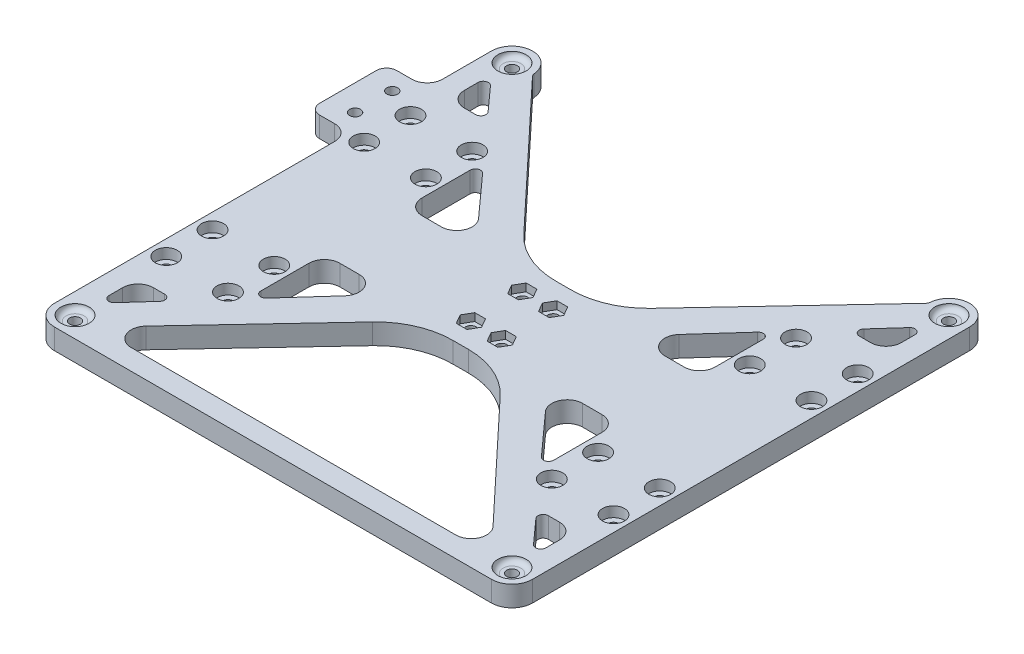
from build123d import *

# Parameters (mm, degrees)
SKETCH1_R           = 2.1
BOSS_EXTRUDE1_DEPTH = 8
FILLET2_R           = 4
SKETCH2_R           = 2.1
CUT_EXTRUDE1_DEPTH  = 10
CUT_EXTRUDE2_DEPTH  = 3
SKETCH4_R           = 2.125
CUT_EXTRUDE3_DEPTH  = 10
CUT_EXTRUDE4_DEPTH  = 3
SKETCH6_W           = 36
SKETCH6_H           = 32
SKETCH6_W_2         = 55
BOSS_EXTRUDE2_DEPTH = 8
SKETCH7_R           = 2.1
CUT_EXTRUDE5_DEPTH  = 10
SKETCH8_W           = 28
SKETCH8_H           = 6.5
SKETCH8_W_2         = 23
SKETCH8_H_2         = 6
BOSS_EXTRUDE3_DEPTH = 8
FILLET3_R           = 6
FILLET4_R           = 2
FILLET5_R           = 30
SKETCH9_R           = 4.25
CUT_EXTRUDE6_DEPTH  = 4
SKETCH10_R          = 5.5
CUT_EXTRUDE7_DEPTH  = 2
FILLET6_R           = 2


with BuildPart() as part:
    # Sketch1 → Boss-Extrude1 (new body)
    with BuildSketch(Plane(origin=(0, 0, 0), x_dir=(1, 0, 0), z_dir=(0, 1, 0))):
        with BuildLine():
            Line((8, 170), (69, 105))
            Line((69, 105), (101, 105))
            Line((101, 105), (162, 170))
            ThreePointArc((162, 170), (170, 178), (178, 170))
            Line((178, 170), (178, 0))
            ThreePointArc((178, 0), (175.656854249, -5.656854249), (170, -8))
            Line((170, -8), (0, -8))
            ThreePointArc((0, -8), (-5.656854249, -5.656854249), (-8, 0))
            Line((-8, 0), (-8, 115))
            Line((-8, 115), (-23.805991578, 115))
            Line((-23.805991578, 115), (-23.805991578, 145))
            Line((-23.805991578, 145), (-8, 145))
            Line((-8, 145), (-8, 170))
            ThreePointArc((-8, 170), (0, 178), (8, 170))
        make_face()
        with Locations(Location((0, 170, 0), (0, 0, 270))):
            Circle(SKETCH1_R, mode=Mode.SUBTRACT)
        with Locations(Location((170, 170, 0), (0, 0, 270))):
            Circle(SKETCH1_R, mode=Mode.SUBTRACT)
        with Locations(Location((170, 0, 0), (0, 0, 270))):
            Circle(SKETCH1_R, mode=Mode.SUBTRACT)
        with Locations(Location((0, 0, 0), (0, 0, 270))):
            Circle(SKETCH1_R, mode=Mode.SUBTRACT)
        Polygon((0, 162), (55, 101), (0, 101), align=None, mode=Mode.SUBTRACT)
        Polygon((55, 69), (0, 8), (0, 69), align=None, mode=Mode.SUBTRACT)
        Polygon((8, 0), (69, 65), (101, 65), (162, 0), align=None, mode=Mode.SUBTRACT)
        Polygon((170, 8), (115, 69), (115, 101), (170, 162), align=None, mode=Mode.SUBTRACT)
    extrude(amount=BOSS_EXTRUDE1_DEPTH)

    # Fillet2
    fillet2_edges = [part.edges().sort_by_distance(p)[0] for p in [
        (-23.805991578, 4, -145),
        (-23.805991578, 4, -115),
    ]]
    fillet(fillet2_edges, radius=FILLET2_R)

    # Sketch2 → Cut-Extrude1 (cut)
    with BuildSketch(Plane(origin=(0, 8, 0), x_dir=(1, 0, 0), z_dir=(0, 1, 0))):
        with Locations(Location((79, 95, 0), (0, 0, 270))):
            Circle(SKETCH2_R)
        with Locations(Location((91, 95, 0), (0, 0, 270))):
            Circle(SKETCH2_R)
        with Locations(Location((91, 75, 0), (0, 0, 270))):
            Circle(SKETCH2_R)
        with Locations(Location((79, 75, 0), (0, 0, 270))):
            Circle(SKETCH2_R)
    extrude(amount=-CUT_EXTRUDE1_DEPTH, mode=Mode.SUBTRACT)

    # Sketch3 → Cut-Extrude2 (cut)
    with BuildSketch(Plane(origin=(0, 8, 0), x_dir=(1, 0, 0), z_dir=(0, 1, 0))):
        Polygon((81.078460969, 91.4), (83.156921938, 95), (81.078460969, 98.6), (76.921539031, 98.6), (74.843078062, 95), (76.921539031, 91.4), align=None)
        Polygon((93.078460969, 91.4), (95.156921938, 95), (93.078460969, 98.6), (88.921539031, 98.6), (86.843078062, 95), (88.921539031, 91.4), align=None)
        Polygon((93.078460969, 71.4), (95.156921938, 75), (93.078460969, 78.6), (88.921539031, 78.6), (86.843078062, 75), (88.921539031, 71.4), align=None)
        Polygon((76.921539031, 71.4), (81.078460969, 71.4), (83.156921938, 75), (81.078460969, 78.6), (76.921539031, 78.6), (74.843078062, 75), align=None)
    extrude(amount=-CUT_EXTRUDE2_DEPTH, mode=Mode.SUBTRACT)

    # Sketch4 → Cut-Extrude3 (cut)
    with BuildSketch(Plane(origin=(0, 8, 0), x_dir=(1, 0, 0), z_dir=(0, 1, 0))):
        with Locations(Location((-13.805991578, 137.25, 0), (0, 0, 270))):
            Circle(SKETCH4_R)
        with Locations(Location((-13.805991578, 122.75, 0), (0, 0, 270))):
            Circle(SKETCH4_R)
    extrude(amount=-CUT_EXTRUDE3_DEPTH, mode=Mode.SUBTRACT)

    # Sketch5 → Cut-Extrude4 (cut)
    with BuildSketch(Plane.XZ):
        Polygon((-15.884452547, -133.65), (-17.962913516, -137.25), (-15.884452547, -140.85), (-11.727530609, -140.85), (-9.64906964, -137.25), (-11.727530609, -133.65), align=None)
        Polygon((-15.884452547, -119.15), (-17.962913516, -122.75), (-15.884452547, -126.35), (-11.727530609, -126.35), (-9.64906964, -122.75), (-11.727530609, -119.15), align=None)
    extrude(amount=-CUT_EXTRUDE4_DEPTH, mode=Mode.SUBTRACT)

    # Sketch6 → Boss-Extrude2 (add)
    with BuildSketch(Plane(origin=(0, 8, 0), x_dir=(1, 0, 0), z_dir=(0, 1, 0))):
        with Locations((10, 123.5)):
            Rectangle(SKETCH6_W, SKETCH6_H)
        with Locations((160, 123.5)):
            Rectangle(SKETCH6_W, SKETCH6_H)
        with Locations((160, 46.5)):
            Rectangle(SKETCH6_W, SKETCH6_H)
        with Locations((10, 46.5)):
            Rectangle(SKETCH6_W, SKETCH6_H)
        with Locations((142.5, 85)):
            Rectangle(SKETCH6_W_2, SKETCH6_H)
    extrude(amount=-BOSS_EXTRUDE2_DEPTH)

    # Sketch7 → Cut-Extrude5 (cut)
    with BuildSketch(Plane(origin=(0, 8, 0), x_dir=(1, 0, 0), z_dir=(0, 1, 0))):
        with Locations(Location((-2, 132.5, 0), (0, 0, 270))):
            Circle(SKETCH7_R)
        with Locations(Location((22, 132.5, 0), (0, 0, 270))):
            Circle(SKETCH7_R)
        with Locations(Location((22, 114.5, 0), (0, 0, 270))):
            Circle(SKETCH7_R)
        with Locations(Location((-2, 114.5, 0), (0, 0, 270))):
            Circle(SKETCH7_R)
        with Locations(Location((-2, 55.5, 0), (0, 0, 270))):
            Circle(SKETCH7_R)
        with Locations(Location((22, 55.5, 0), (0, 0, 270))):
            Circle(SKETCH7_R)
        with Locations(Location((-2, 37.5, 0), (0, 0, 270))):
            Circle(SKETCH7_R)
        with Locations(Location((22, 37.5, 0), (0, 0, 270))):
            Circle(SKETCH7_R)
        with Locations(Location((148, 37.5, 0), (0, 0, 270))):
            Circle(SKETCH7_R)
        with Locations(Location((172, 37.5, 0), (0, 0, 270))):
            Circle(SKETCH7_R)
        with Locations(Location((172, 55.5, 0), (0, 0, 270))):
            Circle(SKETCH7_R)
        with Locations(Location((148, 55.5, 0), (0, 0, 270))):
            Circle(SKETCH7_R)
        with Locations(Location((148, 114.5, 0), (0, 0, 270))):
            Circle(SKETCH7_R)
        with Locations(Location((172, 114.5, 0), (0, 0, 270))):
            Circle(SKETCH7_R)
        with Locations(Location((172, 132.5, 0), (0, 0, 270))):
            Circle(SKETCH7_R)
        with Locations(Location((148, 132.5, 0), (0, 0, 270))):
            Circle(SKETCH7_R)
    extrude(amount=-CUT_EXTRUDE5_DEPTH, mode=Mode.SUBTRACT)

    # Sketch8 → Boss-Extrude3 (add)
    with BuildSketch(Plane(origin=(0, 8, 0), x_dir=(1, 0, 0), z_dir=(0, 1, 0))):
        with Locations((14, 104.25)):
            Rectangle(SKETCH8_W, SKETCH8_H)
        with Locations((14, 65.75)):
            Rectangle(SKETCH8_W, SKETCH8_H)
        with Locations((156, 65.75)):
            Rectangle(SKETCH8_W, SKETCH8_H)
        with Locations((156, 104.25)):
            Rectangle(SKETCH8_W, SKETCH8_H)
        with Locations((11.5, 27.5)):
            Rectangle(SKETCH8_W_2, SKETCH8_H_2)
        with Locations((158.5, 27.5)):
            Rectangle(SKETCH8_W_2, SKETCH8_H_2)
        with Locations((11.5, 142.5)):
            Rectangle(SKETCH8_W_2, SKETCH8_H_2)
        with Locations((158.5, 142.5)):
            Rectangle(SKETCH8_W_2, SKETCH8_H_2)
    extrude(amount=-BOSS_EXTRUDE3_DEPTH)

    # Fillet3
    fillet3_edges = [part.edges().sort_by_distance(p)[0] for p in [
        (-8, 4, -145),
        (-8, 4, -115),
        (28, 4, -101),
        (28, 4, -69),
        (55, 4, -101),
        (142, 4, -69),
        (142, 4, -101),
        (0, 4, -24.5),
        (170, 4, -24.5),
        (0, 4, -145.5),
        (170, 4, -145.5),
        (8, 4, 0),
        (162, 4, 0),
        (55, 4, -69),
        (115, 4, -101),
        (115, 4, -69),
    ]]
    fillet(fillet3_edges, radius=FILLET3_R)

    # Fillet4
    fillet4_edges = [part.edges().sort_by_distance(p)[0] for p in [
        (8, 4, -170),
        (162, 4, -170),
        (142, 4, -130.945454545),
        (28, 4, -130.945454545),
        (142, 4, -39.054545455),
        (28, 4, -39.054545455),
        (0, 4, -162),
        (14.87704918, 4, -24.5),
        (155.12295082, 4, -24.5),
        (14.87704918, 4, -145.5),
        (155.12295082, 4, -145.5),
        (0, 4, -8),
        (170, 4, -8),
        (170, 4, -162),
    ]]
    fillet(fillet4_edges, radius=FILLET4_R)

    # Fillet5
    fillet5_edges = [part.edges().sort_by_distance(p)[0] for p in [
        (69, 4, -105),
        (101, 4, -105),
        (101, 4, -65),
        (69, 4, -65),
    ]]
    fillet(fillet5_edges, radius=FILLET5_R)

    # Sketch9 → Cut-Extrude6 (cut)
    with BuildSketch(Plane(origin=(0, 8, 0), x_dir=(1, 0, 0), z_dir=(0, 1, 0))):
        with Locations(Location((22, 132.5, 0), (0, 0, 270))):
            Circle(SKETCH9_R)
        with Locations(Location((22, 114.5, 0), (0, 0, 270))):
            Circle(SKETCH9_R)
        with Locations(Location((-2, 114.5, 0), (0, 0, 270))):
            Circle(SKETCH9_R)
        with Locations(Location((-2, 132.5, 0), (0, 0, 270))):
            Circle(SKETCH9_R)
        with Locations(Location((-2, 55.5, 0), (0, 0, 270))):
            Circle(SKETCH9_R)
        with Locations(Location((22, 55.5, 0), (0, 0, 270))):
            Circle(SKETCH9_R)
        with Locations(Location((22, 37.5, 0), (0, 0, 270))):
            Circle(SKETCH9_R)
        with Locations(Location((-2, 37.5, 0), (0, 0, 270))):
            Circle(SKETCH9_R)
        with Locations(Location((148, 37.5, 0), (0, 0, 270))):
            Circle(SKETCH9_R)
        with Locations(Location((148, 55.5, 0), (0, 0, 270))):
            Circle(SKETCH9_R)
        with Locations(Location((172, 55.5, 0), (0, 0, 270))):
            Circle(SKETCH9_R)
        with Locations(Location((172, 37.5, 0), (0, 0, 270))):
            Circle(SKETCH9_R)
        with Locations(Location((172, 114.5, 0), (0, 0, 270))):
            Circle(SKETCH9_R)
        with Locations(Location((172, 132.5, 0), (0, 0, 270))):
            Circle(SKETCH9_R)
        with Locations(Location((148, 132.5, 0), (0, 0, 270))):
            Circle(SKETCH9_R)
        with Locations(Location((148, 114.5, 0), (0, 0, 270))):
            Circle(SKETCH9_R)
    extrude(amount=-CUT_EXTRUDE6_DEPTH, mode=Mode.SUBTRACT)

    # Sketch10 → Cut-Extrude7 (cut)
    with BuildSketch(Plane(origin=(0, 8, 0), x_dir=(1, 0, 0), z_dir=(0, 1, 0))):
        with Locations(Location((0, 0, 0), (0, 0, 270))):
            Circle(SKETCH10_R)
        with Locations(Location((0, 170, 0), (0, 0, 270))):
            Circle(SKETCH10_R)
        with Locations(Location((170, 170, 0), (0, 0, 270))):
            Circle(SKETCH10_R)
        with Locations(Location((170, 0, 0), (0, 0, 270))):
            Circle(SKETCH10_R)
    extrude(amount=-CUT_EXTRUDE7_DEPTH, mode=Mode.SUBTRACT)

    # Fillet6
    fillet6_edges = [part.edges().sort_by_distance(p)[0] for p in [
        (170, 6, -5.5),
        (170, 6, -175.5),
        (0, 6, -175.5),
        (0, 6, -5.5),
    ]]
    fillet(fillet6_edges, radius=FILLET6_R - 0.0001)  # a hair under: the kernel refuses the full size


solid = part.part
